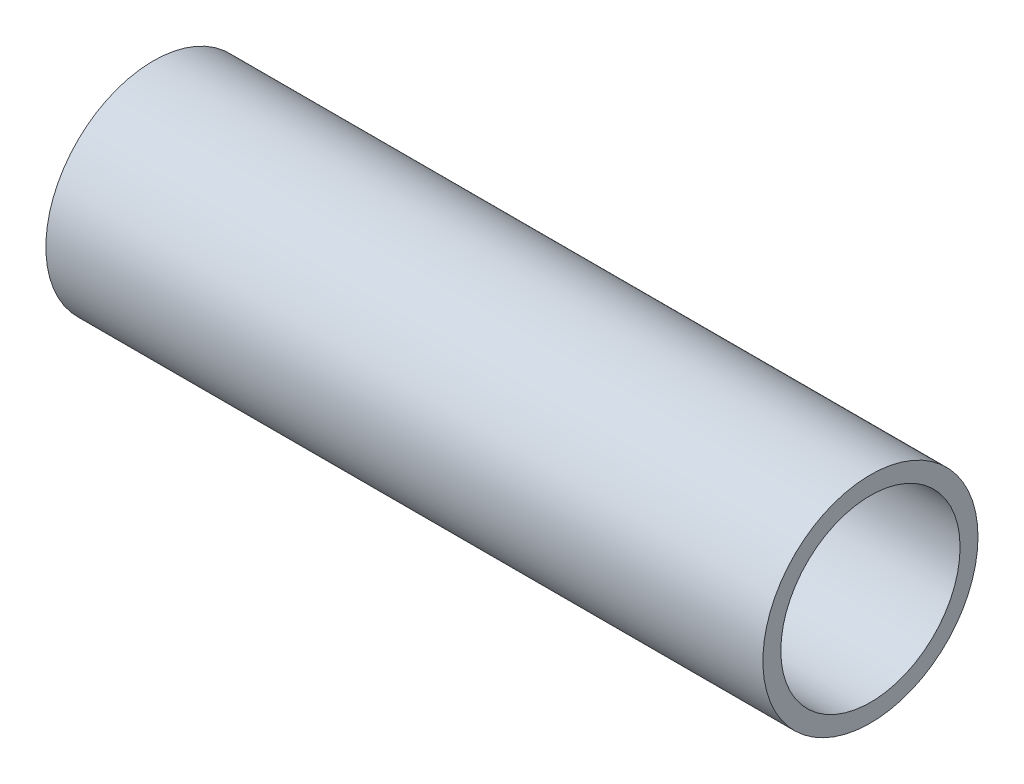
from build123d import *

# Parameters (mm, degrees)
SKETCH1_R           = 1.905
SKETCH1_R_2         = 1.5875
BOSS_EXTRUDE1_DEPTH = 12.7


with BuildPart() as part:
    # Sketch1 → Boss-Extrude1 (new body)
    with BuildSketch(Plane(origin=(0, 0, 0), x_dir=(0, 0, -1), z_dir=(1, 0, 0))):
        Circle(SKETCH1_R)
        Circle(SKETCH1_R_2, mode=Mode.SUBTRACT)
    extrude(amount=BOSS_EXTRUDE1_DEPTH)


solid = part.part
